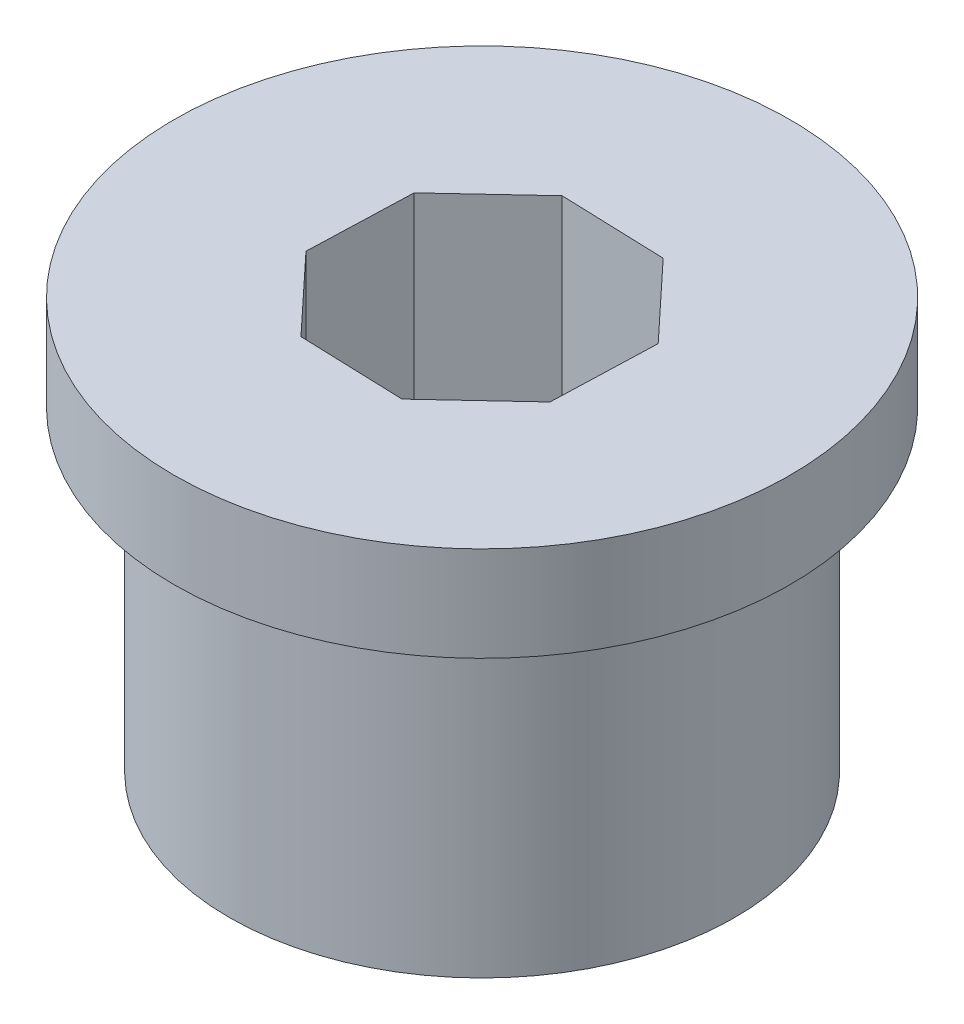
from build123d import *

# Parameters (mm, degrees)
SKETCH1_R           = 8
BOSS_EXTRUDE1_DEPTH = 10
SKETCH2_R           = 9.75
BOSS_EXTRUDE2_DEPTH = 3
CUT_EXTRUDE1_DEPTH  = 19.950593658


with BuildPart() as part:
    # Sketch1 → Boss-Extrude1 (new body)
    with BuildSketch(Plane(origin=(0, 0, 0), x_dir=(1, 0, 0), z_dir=(0, 1, 0))):
        Circle(SKETCH1_R)
    extrude(amount=BOSS_EXTRUDE1_DEPTH)

    # Sketch2 → Boss-Extrude2 (add)
    with BuildSketch(Plane(origin=(0, 10, 0), x_dir=(1, 0, 0), z_dir=(0, 1, 0))):
        Circle(SKETCH2_R)
    extrude(amount=BOSS_EXTRUDE2_DEPTH)

    # Sketch3 → Cut-Extrude1 (cut, through all)
    with BuildSketch(Plane(origin=(0, 13, 0), x_dir=(1, 0, 0), z_dir=(0, 1, 0))):
        Polygon((3.941633327, -1.791282422), (4.053783603, 1.520527707), (1.791282422, 3.941633327), (-1.520527707, 4.053783603), (-3.941633327, 1.791282422), (-4.053783603, -1.520527707), (-1.791282422, -3.941633327), (1.520527707, -4.053783603), align=None)
    extrude(amount=-CUT_EXTRUDE1_DEPTH, mode=Mode.SUBTRACT)


solid = part.part
